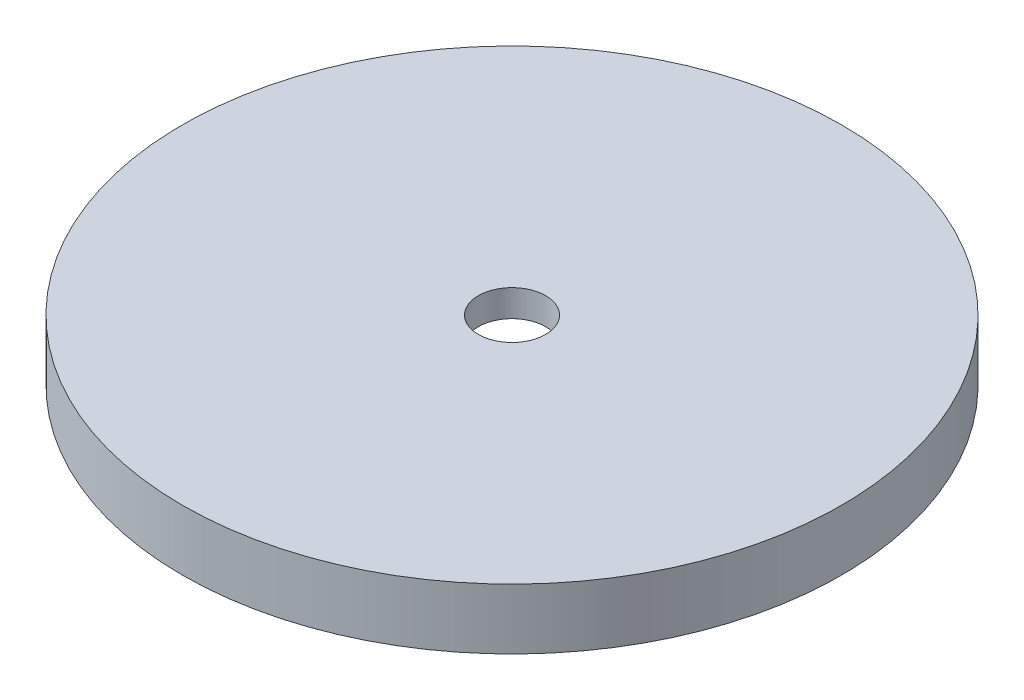
from build123d import *

# Parameters (mm, degrees)
SKETCH1_R           = 24.5
SKETCH1_R_2         = 18.5
BOSS_EXTRUDE1_DEPTH = 2.5
SKETCH2_R           = 24.5
BOSS_EXTRUDE2_DEPTH = 2
SKETCH3_R           = 2.5
CUT_EXTRUDE1_DEPTH  = 35.939232962


with BuildPart() as part:
    # Sketch1 → Boss-Extrude1 (new body)
    with BuildSketch(Plane(origin=(0, 0, 0), x_dir=(1, 0, 0), z_dir=(0, 1, 0))):
        Circle(SKETCH1_R)
        Circle(SKETCH1_R_2, mode=Mode.SUBTRACT)
    extrude(amount=BOSS_EXTRUDE1_DEPTH)

    # Sketch2 → Boss-Extrude2 (add)
    with BuildSketch(Plane(origin=(0, 2.5, 0), x_dir=(1, 0, 0), z_dir=(0, 1, 0))):
        Circle(SKETCH2_R)
    extrude(amount=BOSS_EXTRUDE2_DEPTH)

    # Sketch3 → Cut-Extrude1 (cut, through all)
    with BuildSketch(Plane.XZ):
        Circle(SKETCH3_R)
    extrude(amount=-CUT_EXTRUDE1_DEPTH, mode=Mode.SUBTRACT)


solid = part.part
